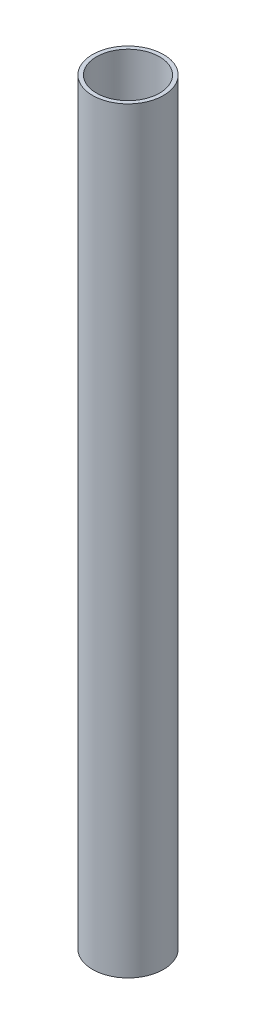
from build123d import *

# Parameters (mm, degrees)
SKETCH1_R           = 57.15
SKETCH1_R_2         = 50.8
BOSS_EXTRUDE1_DEPTH = 609.6


with BuildPart() as part:
    # Sketch1 → Boss-Extrude1 (new, symmetric)
    with BuildSketch(Plane(origin=(0, 0, 0), x_dir=(1, 0, 0), z_dir=(0, 1, 0))):
        Circle(SKETCH1_R)
        Circle(SKETCH1_R_2, mode=Mode.SUBTRACT)
    extrude(amount=BOSS_EXTRUDE1_DEPTH, both=True)


solid = part.part
